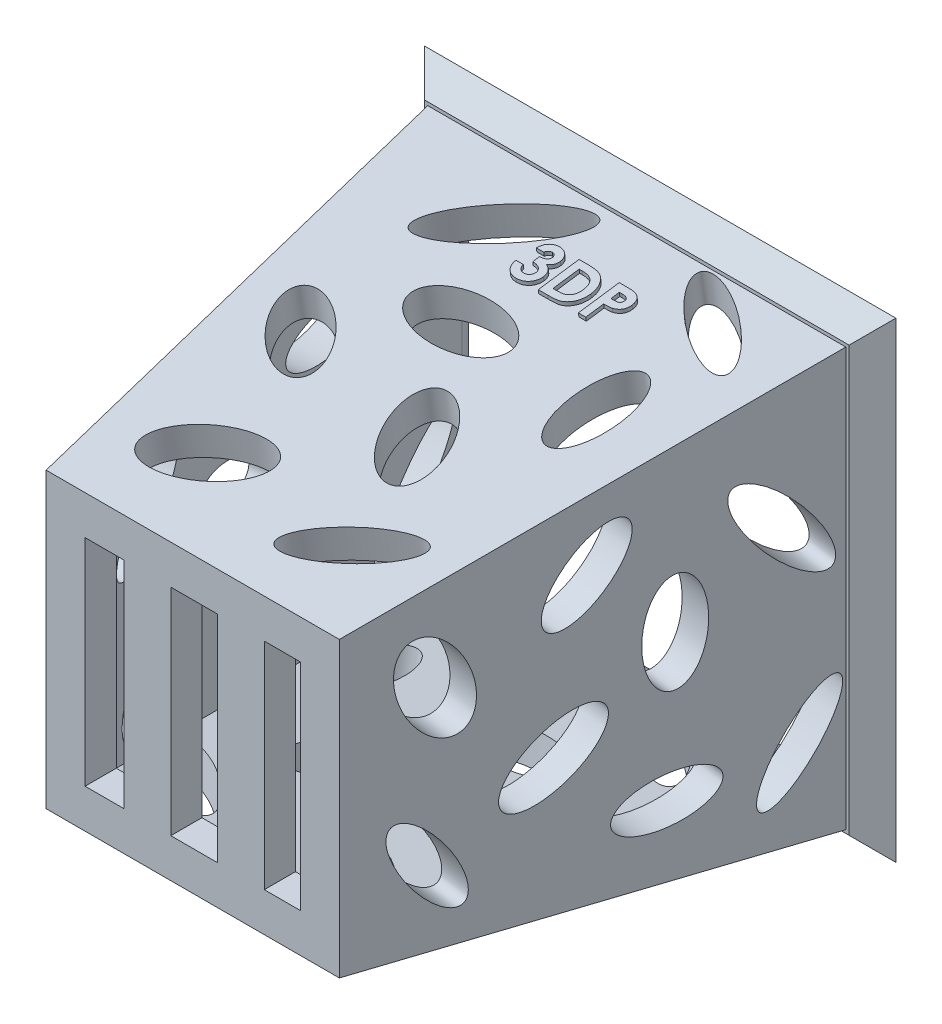
from build123d import *

# Parameters (mm, degrees)
SKETCH1_W           = 54.5
SKETCH1_H           = 54.5
BOSS_EXTRUDE1_DEPTH = 60
BOSS_EXTRUDE1_TAPER = 8
SHELL1_T            = -4
SKETCH3_RX          = 7.217087255
SKETCH3_RY          = 2.511820557
SKETCH3_RX_2        = 6.828362263
SKETCH3_RY_2        = 3.838681894
SKETCH3_RX_3        = 6.835935383
SKETCH3_RY_3        = 3.525334642
SKETCH3_RX_4        = 6.387137935
SKETCH3_RY_4        = 2.996586031
SKETCH3_RX_5        = 6.43289366
SKETCH3_RY_5        = 3.802210886
SKETCH3_RX_6        = 6.372625058
SKETCH3_RY_6        = 3.239831329
SKETCH3_RX_7        = 8.759969622
SKETCH3_RY_7        = 2.71109712
SKETCH3_RX_8        = 7.384009632
SKETCH3_RY_8        = 2.45662592
CUT_EXTRUDE1_DEPTH  = 9
CIRPATTERN1_COUNT   = 4
SKETCH4_W           = 5
SKETCH4_H           = 27.635099836
SKETCH4_W_2         = 6
SKETCH4_W_3         = 4.635099836
CUT_EXTRUDE2_DEPTH  = 9
WRAP1_DEPTH         = 0.5
SKETCH7_W           = 60.5
SKETCH7_H           = 60.5
SKETCH7_W_2         = 50.5
SKETCH7_H_2         = 50.5
BOSS_EXTRUDE2_DEPTH = 3
CHAMFER1_SIZE       = 3
FILLET2_R           = 3


# Read off the part's stored shape, not the designer's step: Wrap1
with BuildPart() as part:
    # Sketch1 → Boss-Extrude1 (new body)
    with BuildSketch(Plane.XY):
        Rectangle(SKETCH1_W, SKETCH1_H)
    extrude(amount=BOSS_EXTRUDE1_DEPTH, taper=BOSS_EXTRUDE1_TAPER)

    # Shell1
    shell1_openings = [part.faces().sort_by_distance(p)[0] for p in [
        (0, 0, 0),
    ]]
    offset(amount=SHELL1_T, openings=shell1_openings, kind=Kind.INTERSECTION)

    # Sketch3 → Cut-Extrude1 (cut)
    with BuildSketch(Plane(origin=(0, -26.722190607, 3.755558973), x_dir=(1, 0, 0), z_dir=(0, -0.9902680687415703, 0.13917310096006574))):
        with Locations(Location((-10.566781187, 46.820917356), (0, 0, 35.664393062))):
            Ellipse(SKETCH3_RX, SKETCH3_RY)
        with Locations(Location((8.850443413, 45.926128188), (0, 0, 29.02475333))):
            Ellipse(SKETCH3_RX_2, SKETCH3_RY_2)
        with Locations(Location((-4.692767806, 32.460077834), (0, 0, -61.664943273))):
            Ellipse(SKETCH3_RX_3, SKETCH3_RY_3)
        with Locations(Location((-14.936360993, 19.585913736), (0, 0, 90))):
            Ellipse(SKETCH3_RX_4, SKETCH3_RY_4)
        with Locations((3.400585701, 18.626132584)):
            Ellipse(SKETCH3_RX_5, SKETCH3_RY_5)
        with Locations(Location((13.997843722, 28.685529615), (0, 0, 132.852347583))):
            Ellipse(SKETCH3_RX_6, SKETCH3_RY_6)
        with Locations(Location((9.833479361, 6.527185163), (0, 0, -138.703181573))):
            Ellipse(SKETCH3_RX_7, SKETCH3_RY_7)
        with Locations(Location((-14.936360993, 4.490335779), (0, 0, -37.453415278))):
            Ellipse(SKETCH3_RX_8, SKETCH3_RY_8)
    cut_extrude1 = extrude(amount=-CUT_EXTRUDE1_DEPTH, mode=Mode.SUBTRACT)

    # CirPattern1: Cut-Extrude1 ×4 about axis
    cirpattern1_axis = Axis((0, 0, -3), (0, 0, 1))
    for i in range(1, CIRPATTERN1_COUNT):
        add(cut_extrude1.rotate(cirpattern1_axis, i * 360 / CIRPATTERN1_COUNT), mode=Mode.SUBTRACT)

    # Sketch4 → Cut-Extrude2 (cut)
    with BuildSketch(Plane.XY.offset(60)):
        with Locations((-11.317549918, 0)):
            Rectangle(SKETCH4_W, SKETCH4_H)
        with Locations((0.182450082, 0)):
            Rectangle(SKETCH4_W_2, SKETCH4_H)
        with Locations((11.5, 0)):
            Rectangle(SKETCH4_W_3, SKETCH4_H)
    extrude(amount=-CUT_EXTRUDE2_DEPTH, mode=Mode.SUBTRACT)

    # Wrap1 outline → Wrap1 (add)
    # profile 1 of 3: a face of its own
    with BuildSketch(Plane(origin=(0, 26.722190607, 3.755558973), x_dir=(1, 0, 0), z_dir=(0, 0.9902680687415703, 0.13917310096006574))):
        with BuildLine():
            add(Edge.make_bspline(
                [(-4.700917722, -7.442152714), (-4.69421187, -7.394676284), (-4.68106549, -7.301601888), (-4.649607961, -7.166853348), (-4.611981361, -7.039035136), (-4.565006475, -6.918552027), (-4.509912574, -6.805189399), (-4.447259904, -6.698558248), (-4.376371166, -6.599116254), (-4.322034197, -6.539212002), (-4.29492647, -6.509326859)],
                knots=[0, 0, 0, 0, 0.138934236, 0.272371367, 0.40070198, 0.524915333, 0.646775011, 0.765706493, 0.883115226, 1, 1, 1, 1], degree=3))
            Line((-4.700917722, -7.442152714), (-3.751131398, -7.442152714))
            add(Edge.make_bspline(
                [(-3.13207424, -6.967259552), (-3.166487769, -6.968953455), (-3.234774751, -6.972314679), (-3.334630757, -6.997401963), (-3.429460695, -7.039633283), (-3.517300904, -7.097867784), (-3.596883392, -7.167804952), (-3.662197654, -7.25063101), (-3.71652296, -7.341383706), (-3.739550027, -7.408431364), (-3.751131398, -7.442152714)],
                knots=[0, 0, 0, 0, 0.123522589, 0.245106649, 0.36726561, 0.494690546, 0.622323873, 0.746002836, 0.872253148, 1, 1, 1, 1], degree=3))
            add(Edge.make_bspline(
                [(-2.597819432, -7.46547336), (-2.599659643, -7.431022127), (-2.603251345, -7.363780614), (-2.631146453, -7.267543843), (-2.679569198, -7.181756739), (-2.744495598, -7.106599821), (-2.823610673, -7.04382313), (-2.91634741, -6.998248322), (-3.020693416, -6.971471088), (-3.094106454, -6.968695191), (-3.13207424, -6.967259552)],
                knots=[0, 0, 0, 0, 0.126208081, 0.246331455, 0.363483818, 0.484754462, 0.608382757, 0.731214254, 0.860989275, 1, 1, 1, 1], degree=3))
            add(Edge.make_bspline(
                [(-3.615447637, -8.120571517), (-3.552489344, -8.115209788), (-3.434706846, -8.105179053), (-3.271218423, -8.081721832), (-3.133582246, -8.050367394), (-3.018490226, -8.012539962), (-2.922925187, -7.963959684), (-2.839440097, -7.910329202), (-2.767538788, -7.848045234), (-2.706772537, -7.778965082), (-2.658161427, -7.704779476), (-2.623757315, -7.62664148), (-2.601038637, -7.546968782), (-2.598886044, -7.492475057), (-2.597819432, -7.46547336)],
                knots=[0, 0, 0, 0, 0.141703761, 0.265099674, 0.370057991, 0.458023549, 0.535993518, 0.609847615, 0.680075159, 0.748587094, 0.815630364, 0.878070744, 0.939583928, 1, 1, 1, 1], degree=3))
            Line((-3.615447637, -8.120571517), (-3.615447637, -9.002515962))
            add(Edge.make_bspline(
                [(-2.326451911, -9.857959672), (-2.327458041, -9.828912644), (-2.329461015, -9.771086668), (-2.345825527, -9.686701816), (-2.37166855, -9.605530388), (-2.407567665, -9.527931851), (-2.455506933, -9.454192218), (-2.512074734, -9.382832048), (-2.581727675, -9.317565511), (-2.658146281, -9.253051517), (-2.746761841, -9.196814771), (-2.843258656, -9.144916518), (-2.95017281, -9.103621531), (-3.064894434, -9.066737459), (-3.189593594, -9.039797905), (-3.323495956, -9.020237163), (-3.466385513, -9.005677223), (-3.564881143, -9.00358836), (-3.615447637, -9.002515962)],
                knots=[0, 0, 0, 0, 0.05061342, 0.100759723, 0.149274813, 0.198888438, 0.249306497, 0.302322686, 0.357220648, 0.415437322, 0.476442931, 0.539828648, 0.606183849, 0.675941201, 0.749782408, 0.828287688, 0.911844924, 1, 1, 1, 1], degree=3))
            add(Edge.make_bspline(
                [(-3.159635003, -10.63072109), (-3.130274224, -10.630217602), (-3.072763027, -10.62923138), (-2.988287642, -10.618300435), (-2.907812943, -10.600297161), (-2.831189042, -10.575831378), (-2.757928147, -10.54516199), (-2.689429981, -10.505615649), (-2.624298379, -10.459637382), (-2.563241382, -10.407945604), (-2.506823459, -10.351620071), (-2.459880428, -10.289249112), (-2.416977895, -10.22586907), (-2.385246873, -10.157333399), (-2.357443661, -10.087330051), (-2.340426675, -10.013318123), (-2.327577629, -9.936850186), (-2.326830894, -9.884518888), (-2.326451911, -9.857959672)],
                knots=[0, 0, 0, 0, 0.069402223, 0.135943428, 0.201020377, 0.264180635, 0.325954798, 0.388453791, 0.450818569, 0.51426562, 0.577492176, 0.638835299, 0.698633645, 0.758057149, 0.817032435, 0.876414798, 0.937277956, 1, 1, 1, 1], degree=3))
            add(Edge.make_bspline(
                [(-4.022498919, -9.816618526), (-4.016480222, -9.849899018), (-4.004757232, -9.914721503), (-3.981892257, -10.008570051), (-3.952096006, -10.095198057), (-3.917644126, -10.175375469), (-3.880430909, -10.250154988), (-3.835468444, -10.316774822), (-3.786051344, -10.377043972), (-3.714742109, -10.448692602), (-3.612800645, -10.522308578), (-3.475145896, -10.586284364), (-3.322018024, -10.623782034), (-3.21496637, -10.628356634), (-3.159635003, -10.63072109)],
                knots=[0, 0, 0, 0, 0.077346353, 0.150652305, 0.220677485, 0.286575187, 0.35018847, 0.411378839, 0.469946039, 0.528233786, 0.642194432, 0.755364323, 0.873556122, 1, 1, 1, 1], degree=3))
            Line((-4.022498919, -9.816618526), (-4.972285244, -9.816618526))
            add(Edge.make_bspline(
                [(-3.211576443, -11.580507415), (-3.273481999, -11.579156967), (-3.394530122, -11.576516345), (-3.571588336, -11.553660426), (-3.739865409, -11.516791973), (-3.899790786, -11.464822831), (-4.050745729, -11.397427735), (-4.194099157, -11.317175297), (-4.326990482, -11.219436745), (-4.450900377, -11.108624179), (-4.563080146, -10.984298773), (-4.663342441, -10.849340462), (-4.749476462, -10.703236055), (-4.821835446, -10.546609771), (-4.879853708, -10.379186841), (-4.925618343, -10.201307727), (-4.957585689, -10.012624908), (-4.967321412, -9.882807115), (-4.972285244, -9.816618526)],
                knots=[0, 0, 0, 0, 0.066659045, 0.130342942, 0.191936224, 0.251995802, 0.311121943, 0.3697548, 0.428602208, 0.488435845, 0.548524359, 0.60866107, 0.669235799, 0.730880799, 0.794196272, 0.859830406, 0.928533466, 1, 1, 1, 1], degree=3))
            add(Edge.make_bspline(
                [(-1.376665586, -9.867499936), (-1.378481986, -9.926214678), (-1.382063556, -10.041988191), (-1.404833507, -10.212510729), (-1.447227052, -10.375088817), (-1.502998109, -10.531593164), (-1.577390646, -10.680003355), (-1.664938156, -10.823725202), (-1.772551635, -10.957774469), (-1.89214554, -11.085695074), (-2.024961543, -11.201994759), (-2.168955697, -11.302821353), (-2.320961695, -11.38934851), (-2.481941234, -11.459593721), (-2.651838388, -11.513690568), (-2.830274471, -11.552794262), (-3.017999221, -11.57671855), (-3.14613605, -11.579226557), (-3.211576443, -11.580507415)],
                knots=[0, 0, 0, 0, 0.062821161, 0.123870535, 0.183554169, 0.242266291, 0.301264887, 0.360846687, 0.4219487, 0.484789191, 0.548013913, 0.610412876, 0.672536447, 0.73482884, 0.797947255, 0.862973491, 0.930019585, 1, 1, 1, 1], degree=3))
            add(Edge.make_bspline(
                [(-2.356132733, -8.513842418), (-2.318414064, -8.526226251), (-2.244298571, -8.550559928), (-2.138952309, -8.598484829), (-2.038780051, -8.650858803), (-1.945506728, -8.711703554), (-1.858204624, -8.77855879), (-1.777405943, -8.851996015), (-1.702627931, -8.9318551), (-1.635091309, -9.01857524), (-1.575149919, -9.110769517), (-1.521367701, -9.206308296), (-1.477101938, -9.306640439), (-1.439603325, -9.410620088), (-1.411054017, -9.519181755), (-1.390952752, -9.631904774), (-1.379333728, -9.748532015), (-1.377561629, -9.8275469), (-1.376665586, -9.867499936)],
                knots=[0, 0, 0, 0, 0.066221473, 0.130122224, 0.19292189, 0.254764174, 0.315756781, 0.376302843, 0.436814419, 0.498168159, 0.559516228, 0.620243021, 0.680969814, 0.742349065, 0.804583897, 0.868102398, 0.93330738, 1, 1, 1, 1], degree=3))
            add(Edge.make_bspline(
                [(-1.648033107, -7.405051686), (-1.650238954, -7.462477112), (-1.654581587, -7.57553012), (-1.690216042, -7.740991597), (-1.745993653, -7.899202297), (-1.826569837, -8.047948615), (-1.92731059, -8.186825745), (-2.05091612, -8.311190609), (-2.19386582, -8.42299308), (-2.301180064, -8.483075741), (-2.356132733, -8.513842418)],
                knots=[0, 0, 0, 0, 0.124100703, 0.24431613, 0.364465941, 0.485853993, 0.608914794, 0.734300919, 0.863942817, 1, 1, 1, 1], degree=3))
            add(Edge.make_bspline(
                [(-3.125714063, -6.017473227), (-3.074426679, -6.018684022), (-2.973606017, -6.0210642), (-2.825425012, -6.040170979), (-2.684146824, -6.073682143), (-2.548278103, -6.117497237), (-2.419817033, -6.177114996), (-2.295928355, -6.246318525), (-2.180073522, -6.331199529), (-2.071981457, -6.427106521), (-1.97267828, -6.530839322), (-1.886681293, -6.641721155), (-1.81274814, -6.756790111), (-1.751837002, -6.877002195), (-1.705004613, -7.002560821), (-1.672501547, -7.132740654), (-1.651227501, -7.267254442), (-1.64910805, -7.358681652), (-1.648033107, -7.405051686)],
                knots=[0, 0, 0, 0, 0.068213911, 0.134094803, 0.198285615, 0.261160186, 0.323634654, 0.38636675, 0.449642386, 0.514244902, 0.578413338, 0.640374686, 0.70061485, 0.760103977, 0.81929898, 0.878465984, 0.938360402, 1, 1, 1, 1], degree=3))
            add(Edge.make_bspline(
                [(-4.29492647, -6.509326859), (-4.255827166, -6.469895579), (-4.178766547, -6.392180669), (-4.049989215, -6.292636454), (-3.915006789, -6.206487705), (-3.771112137, -6.138188354), (-3.620544369, -6.082907942), (-3.462106117, -6.045775964), (-3.296444817, -6.021138569), (-3.18340182, -6.018711699), (-3.125714063, -6.017473227)],
                knots=[0, 0, 0, 0, 0.127406864, 0.251105539, 0.372907792, 0.494496302, 0.616171436, 0.740562898, 0.867604851, 1, 1, 1, 1], degree=3))
        make_face()
    # profile 2 of 3: a face of its own
    with BuildSketch(Plane(origin=(0, 26.722190607, 3.755558973), x_dir=(1, 0, 0), z_dir=(0, 0.9902680687415703, 0.13917310096006574))):
        with BuildLine():
            add(Edge.make_bspline(
                [(0.702052029, -6.153156988), (0.795354263, -6.153809202), (0.975708536, -6.15506994), (1.237006198, -6.169275427), (1.479979772, -6.191122456), (1.704785885, -6.221177005), (1.910963648, -6.260947403), (2.098247199, -6.310831572), (2.267265105, -6.368414547), (2.419870614, -6.436172601), (2.559184766, -6.515171764), (2.691467999, -6.603170488), (2.816460579, -6.703392425), (2.935916578, -6.813904094), (3.048294392, -6.936727271), (3.155465514, -7.06982756), (3.254805909, -7.215135099), (3.349318421, -7.369165872), (3.434792412, -7.532572645), (3.509346021, -7.703964534), (3.571800032, -7.88223857), (3.622547149, -8.067584745), (3.662998458, -8.259387767), (3.691301424, -8.458034675), (3.7087986, -8.663341558), (3.710573542, -8.802488112), (3.71147544, -8.873192378)],
                knots=[0, 0, 0, 0, 0.060148162, 0.116267077, 0.168653955, 0.217398969, 0.262433523, 0.303932701, 0.342259967, 0.377441339, 0.411406099, 0.445398351, 0.479766387, 0.514584482, 0.550213651, 0.587000908, 0.624662987, 0.663615456, 0.703456428, 0.743450162, 0.784013386, 0.825132536, 0.867264663, 0.910306473, 0.954424205, 1, 1, 1, 1], degree=3))
            Line((0.702052029, -6.153156988), (-0.494721141, -6.153156988))
            Line((-0.494721141, -6.153156988), (-0.494721141, -11.444823654))
            Line((-0.494721141, -11.444823654), (0.720072529, -11.444823654))
            add(Edge.make_bspline(
                [(3.71147544, -8.873192378), (3.709113784, -8.972960698), (3.704464727, -9.169360477), (3.665303667, -9.45757489), (3.601966973, -9.733857151), (3.512909828, -9.996046073), (3.402502809, -10.241806825), (3.270609261, -10.466805519), (3.119163052, -10.669834476), (2.949928537, -10.849882778), (2.766688775, -11.004636734), (2.576265712, -11.137172173), (2.376804279, -11.241687425), (2.201050882, -11.307965725), (2.04865076, -11.349185093), (1.914845102, -11.373546136), (1.762855526, -11.395886682), (1.591264864, -11.413150976), (1.400825844, -11.428546483), (1.190779376, -11.436911802), (0.961805528, -11.443862141), (0.802761542, -11.444494752), (0.720072529, -11.444823654)],
                knots=[0, 0, 0, 0, 0.065772947, 0.129477895, 0.191430088, 0.252445668, 0.311786958, 0.36881755, 0.424091518, 0.478492106, 0.531393744, 0.58200397, 0.631201271, 0.679503008, 0.705561374, 0.735221723, 0.769132486, 0.80685832, 0.848929771, 0.895116661, 0.945469804, 1, 1, 1, 1], degree=3))
        make_face()
        with BuildLine():
            add(Edge.make_bspline(
                [(0.951158934, -10.495037329), (1.010186471, -10.494929167), (1.123716076, -10.494721133), (1.287627127, -10.484812331), (1.439203288, -10.474866625), (1.578027305, -10.455989344), (1.705109497, -10.43496138), (1.818704088, -10.40569809), (1.921152754, -10.374959483), (2.011204106, -10.335825426), (2.093683808, -10.29177744), (2.17005059, -10.240170118), (2.243765916, -10.182862134), (2.313451618, -10.118167977), (2.379371439, -10.04694432), (2.441135358, -9.96882418), (2.499567757, -9.884045903), (2.553168789, -9.792161245), (2.602149699, -9.694140529), (2.645601254, -9.590933228), (2.681629006, -9.481679849), (2.711573067, -9.367403133), (2.732971494, -9.247108173), (2.750674611, -9.121685977), (2.759801084, -8.990639632), (2.761053635, -8.901471319), (2.761689115, -8.856231907)],
                knots=[0, 0, 0, 0, 0.062614648, 0.120428813, 0.174199486, 0.223724664, 0.26902845, 0.310765001, 0.348115258, 0.382378114, 0.414753161, 0.447195432, 0.480044579, 0.513738641, 0.547962504, 0.582917814, 0.619315101, 0.657123545, 0.695686576, 0.735513716, 0.7758232, 0.817652262, 0.860742584, 0.905386927, 0.951998197, 1, 1, 1, 1], degree=3))
            Line((0.951158934, -10.495037329), (0.455065184, -10.495037329))
            Line((0.455065184, -10.495037329), (0.455065184, -7.102943312))
            Line((0.455065184, -7.102943312), (0.817595232, -7.102943312))
            add(Edge.make_bspline(
                [(2.262415277, -7.526955064), (2.223057079, -7.492507115), (2.142672415, -7.42215108), (2.001543362, -7.337846556), (1.846026454, -7.26377677), (1.672563932, -7.205047689), (1.482832233, -7.158602228), (1.275701312, -7.12656993), (1.0522804, -7.105986314), (0.897499597, -7.103979378), (0.817595232, -7.102943312)],
                knots=[0, 0, 0, 0, 0.101663476, 0.207636138, 0.318744567, 0.436679942, 0.563506646, 0.698681208, 0.844446556, 1, 1, 1, 1], degree=3))
            add(Edge.make_bspline(
                [(2.761689115, -8.856231907), (2.760423454, -8.786906785), (2.757955514, -8.651728168), (2.734155232, -8.454837562), (2.695412912, -8.269435561), (2.640131355, -8.096210241), (2.570447238, -7.934674749), (2.483221323, -7.786197632), (2.382207475, -7.648284679), (2.302328481, -7.567380515), (2.262415277, -7.526955064)],
                knots=[0, 0, 0, 0, 0.142276686, 0.277428514, 0.406477152, 0.530595072, 0.650142922, 0.766850697, 0.883502093, 1, 1, 1, 1], degree=3))
        make_face(mode=Mode.SUBTRACT)
    # profile 3 of 3: a face of its own
    with BuildSketch(Plane(origin=(0, 26.722190607, 3.755558973), x_dir=(1, 0, 0), z_dir=(0, 0.9902680687415703, 0.13917310096006574))):
        with BuildLine():
            add(Edge.make_bspline(
                [(5.721291145, -6.153156988), (5.79055209, -6.153467014), (5.92417097, -6.154065121), (6.116860388, -6.161317958), (6.294625811, -6.174315485), (6.457426397, -6.190378372), (6.605195207, -6.212897915), (6.738117292, -6.238714808), (6.856220236, -6.270167298), (6.960835825, -6.307500966), (7.054724938, -6.351515904), (7.14357432, -6.398394953), (7.225375966, -6.454343446), (7.304258653, -6.51333149), (7.375712521, -6.580994192), (7.44419529, -6.6528285), (7.506806528, -6.731683303), (7.563836352, -6.816604085), (7.61557119, -6.906021875), (7.660770206, -7.000096523), (7.697433116, -7.098976893), (7.728188739, -7.202023343), (7.752891955, -7.309231379), (7.769335202, -7.421260343), (7.780504283, -7.537328005), (7.7814898, -7.616323728), (7.78198826, -7.656278649)],
                knots=[0, 0, 0, 0, 0.070781161, 0.136551696, 0.197012482, 0.252922694, 0.303686532, 0.349719151, 0.391240471, 0.428478555, 0.463056565, 0.497150358, 0.531002334, 0.564226377, 0.59770067, 0.631421421, 0.665597347, 0.700451436, 0.735880684, 0.771092108, 0.806974845, 0.843534403, 0.880940196, 0.919294384, 0.95918024, 1, 1, 1, 1], degree=3))
            Line((5.721291145, -6.153156988), (4.661261765, -6.153156988))
            Line((4.661261765, -6.153156988), (4.661261765, -11.444823654))
            Line((4.661261765, -11.444823654), (5.611048089, -11.444823654))
            Line((5.611048089, -11.444823654), (5.611048089, -9.138199723))
            add(Edge.make_bspline(
                [(6.689097969, -9.05763749), (6.66197104, -9.064386714), (6.603205376, -9.079007706), (6.505964343, -9.093851683), (6.393904262, -9.107499807), (6.266662769, -9.119228717), (6.124166508, -9.127201644), (5.966553451, -9.133428144), (5.793752172, -9.137955453), (5.673592995, -9.138116102), (5.611048089, -9.138199723)],
                knots=[0, 0, 0, 0, 0.077372749, 0.167614291, 0.272108317, 0.390015992, 0.52136331, 0.667272254, 0.826809521, 1, 1, 1, 1], degree=3))
            add(Edge.make_bspline(
                [(7.78198826, -7.656278649), (7.78126705, -7.700479826), (7.779849784, -7.787340571), (7.765956004, -7.914667766), (7.74222104, -8.036062719), (7.711200682, -8.152549174), (7.667945, -8.262210672), (7.618527414, -8.367663769), (7.557728108, -8.465951885), (7.488255182, -8.558304484), (7.412382821, -8.645472438), (7.328309818, -8.724938936), (7.237638642, -8.7972457), (7.140894154, -8.863150508), (7.037713147, -8.922520418), (6.928170072, -8.975911364), (6.811516905, -9.021615739), (6.73028315, -9.045518758), (6.689097969, -9.05763749)],
                knots=[0, 0, 0, 0, 0.068875425, 0.135348675, 0.199289315, 0.26155008, 0.322915384, 0.382771997, 0.442843572, 0.502652029, 0.562748843, 0.622739582, 0.682687332, 0.743329247, 0.805012514, 0.86806712, 0.933110571, 1, 1, 1, 1], degree=3))
        make_face()
        with BuildLine():
            add(Edge.make_bspline(
                [(5.947077403, -8.188413398), (6.008223242, -8.188025686), (6.120732493, -8.18731229), (6.274380401, -8.176996169), (6.397854814, -8.161241369), (6.495401894, -8.138645343), (6.572424553, -8.10435288), (6.638851774, -8.064682959), (6.695828097, -8.014521433), (6.745161207, -7.957203306), (6.784601542, -7.891341905), (6.81195136, -7.818009656), (6.829717263, -7.738747347), (6.83135811, -7.683586026), (6.832201936, -7.65521862)],
                knots=[0, 0, 0, 0, 0.155159592, 0.285495954, 0.390502806, 0.470975045, 0.538445527, 0.60365534, 0.666587169, 0.73019895, 0.794944675, 0.860228437, 0.928120706, 1, 1, 1, 1], degree=3))
            Line((5.947077403, -8.188413398), (5.611048089, -8.188413398))
            Line((5.611048089, -8.188413398), (5.611048089, -7.102943312))
            Line((5.611048089, -7.102943312), (5.909976375, -7.102943312))
            add(Edge.make_bspline(
                [(6.583095031, -7.207886221), (6.56629657, -7.199390757), (6.530730784, -7.18140412), (6.470158803, -7.160493338), (6.400259662, -7.142852791), (6.320561463, -7.128211307), (6.231382145, -7.116847994), (6.132737619, -7.108157903), (6.02448272, -7.104663279), (5.949197915, -7.103532448), (5.909976375, -7.102943312)],
                knots=[0, 0, 0, 0, 0.08210116, 0.173824981, 0.278953094, 0.396639095, 0.527315592, 0.671298143, 0.82875438, 1, 1, 1, 1], degree=3))
            add(Edge.make_bspline(
                [(6.832201936, -7.65521862), (6.83136679, -7.630434386), (6.829746406, -7.582347013), (6.817842623, -7.512945007), (6.798871418, -7.44824802), (6.77138287, -7.388931727), (6.735846688, -7.335096916), (6.69252089, -7.286764794), (6.641961432, -7.242900288), (6.602926574, -7.219682134), (6.583095031, -7.207886221)],
                knots=[0, 0, 0, 0, 0.137787685, 0.267341238, 0.390444331, 0.511777883, 0.629508981, 0.747829066, 0.87188531, 1, 1, 1, 1], degree=3))
        make_face(mode=Mode.SUBTRACT)
    extrude(amount=WRAP1_DEPTH)

    # Sketch7 → Boss-Extrude2 (add)
    with BuildSketch(Plane(origin=(0, 0, 0), x_dir=(-1, 0, 0), z_dir=(0, 0, -1))):
        Rectangle(SKETCH7_W, SKETCH7_H)
        Rectangle(SKETCH7_W_2, SKETCH7_H_2, mode=Mode.SUBTRACT)
    extrude(amount=-BOSS_EXTRUDE2_DEPTH)

    # Chamfer1
    chamfer1_edges = [part.edges().sort_by_distance(p)[0] for p in [
        (-30.25, 0, 3),
        (0, -30.25, 3),
        (30.25, 0, 3),
        (0, 30.25, 3),
    ]]
    chamfer(chamfer1_edges, length=CHAMFER1_SIZE - 0.0001)  # a hair under: the kernel refuses the full size

    # Fillet2
    fillet2_edges = [part.edges().sort_by_distance(p)[0] for p in [
        (-23.21068971, 0, 0),
        (0, -23.21068971, 0),
        (23.21068971, 0, 0),
        (0, 23.21068971, 0),
    ]]
    fillet(fillet2_edges, radius=FILLET2_R)


solid = part.part
